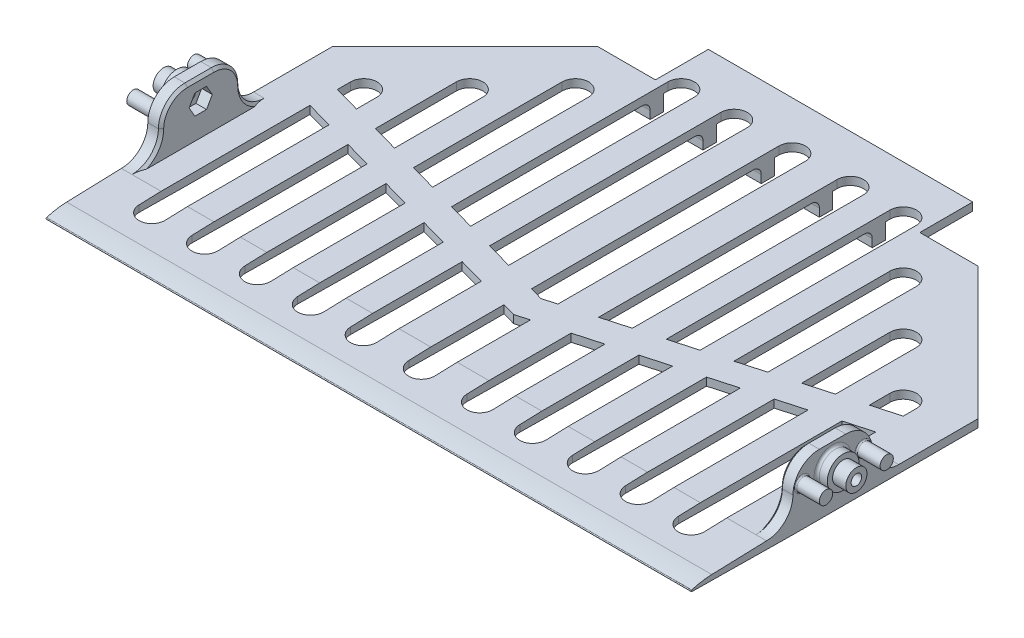
from build123d import *

# Parameters (mm, degrees)
BOSS_EXTRUDE1_DEPTH       = 3
SKETCH2_W                 = 5
SKETCH2_H                 = 30
BOSS_EXTRUDE2_DEPTH       = 20
BOSS_EXTRUDE3_DEPTH       = 4
BOSS_EXTRUDE3_DEPTH_BACK  = 244
SKETCH3_R                 = 6
SKETCH5_R                 = 2
CUT_EXTRUDE2_DEPTH        = 269.389642125
FILLET1_R                 = 10
BOSS_EXTRUDE4_START       = 5
SKETCH6_R                 = 4
SKETCH6_R_2               = 2
BOSS_EXTRUDE4_DEPTH       = 5
CUT_EXTRUDE3_DEPTH        = 238
CUT_EXTRUDE3_DEPTH_BACK   = 4
CUT_EXTRUDE4_DEPTH        = 265.697941057
FILLET9_R                 = 30
FILLET10_R                = 0.3
CUT_EXTRUDE6_DEPTH        = 167.015059558
SKETCH13_R                = 6
SKETCH13_R_2              = 2
BOSS_EXTRUDE7_DEPTH       = 4
SKETCH14_R                = 4
SKETCH14_R_2              = 2
BOSS_EXTRUDE8_DEPTH       = 5
FILLET11_R                = 1
SKETCH15_W                = 144
SKETCH15_H                = 5
BOSS_EXTRUDE9_DEPTH       = 6
FILLET12_R                = 3
BOSS_EXTRUDE10_DEPTH      = 9
BOSS_EXTRUDE10_DEPTH_BACK = 253
SKETCH16_R                = 2.5
FILLET13_R                = 0.5
CUT_EXTRUDE7_DEPTH        = 167.403124971
CUT_EXTRUDE7_DEPTH_BACK   = 167.403124971
SKETCH17_W                = 234
SKETCH17_H                = 22.465273377
CHAMFER1_SIZE             = 1
CUT_EXTRUDE8_DEPTH        = 167.015059558
BOSS_EXTRUDE11_DEPTH      = 3


# Some blends are built 0.0001 mm under size
with BuildPart() as part:
    # Sketch1 → Boss-Extrude1 (new body)
    with BuildSketch(Plane(origin=(0, 0, 0), x_dir=(1, 0, 0), z_dir=(0, 1, 0))):
        Polygon((-122, -80), (122, -80), (122, 80), (50, 80), (50, 100), (-50, 100), (-50, 80), (-122, 80), align=None)
    extrude(amount=BOSS_EXTRUDE1_DEPTH)

    # Sketch2 → Boss-Extrude2 (add)
    with BuildSketch(Plane(origin=(0, 3, 0), x_dir=(1, 0, 0), z_dir=(0, 1, 0))):
        with Locations((-119.5, -25)):
            Rectangle(SKETCH2_W, SKETCH2_H)
        with Locations((119.5, -25)):
            Rectangle(SKETCH2_W, SKETCH2_H)
    extrude(amount=BOSS_EXTRUDE2_DEPTH)

    # Sketch3 → Boss-Extrude3 (add, two sides: drawn at the far end of the back side and taken through both)
    with BuildSketch(Plane.ZY.offset(122).offset(-BOSS_EXTRUDE3_DEPTH_BACK)):
        with Locations((25, 15)):
            Circle(SKETCH3_R)
    extrude(amount=BOSS_EXTRUDE3_DEPTH + BOSS_EXTRUDE3_DEPTH_BACK)

    # Sketch5 → Cut-Extrude2 (cut, through all)
    with BuildSketch(Plane.ZY.offset(126)):
        with Locations((25, 15)):
            Circle(SKETCH5_R)
    extrude(amount=-CUT_EXTRUDE2_DEPTH, mode=Mode.SUBTRACT)

    # Fillet1
    fillet1_edges = [part.edges().sort_by_distance(p)[0] for p in [
        (119.5, 3, 40),
        (119.5, 3, 10),
        (-119.5, 3, 10),
        (-119.5, 3, 40),
    ]]
    fillet(fillet1_edges, radius=FILLET1_R)
    fillet1_2_edges = [part.edges().sort_by_distance(p)[0] for p in [
        (119.5, 23, 40),
        (119.5, 23, 10),
        (-119.5, 23, 10),
        (-119.5, 23, 40),
    ]]
    fillet(fillet1_2_edges, radius=FILLET1_R - 0.0001)  # a hair under: the kernel refuses the full size

    # Sketch6 → Boss-Extrude4 (add)
    with BuildSketch(Plane.ZY.offset(126).offset(BOSS_EXTRUDE4_START)):
        with Locations((25, 15)):
            Circle(SKETCH6_R)
        with Locations((25, 15)):
            Circle(SKETCH6_R_2, mode=Mode.SUBTRACT)
    extrude(amount=-BOSS_EXTRUDE4_DEPTH)

    # Sketch8 → Cut-Extrude3 (cut, two sides: drawn at the far end of the back side and taken through both)
    with BuildSketch(Plane.ZY.offset(-117).offset(-CUT_EXTRUDE3_DEPTH_BACK)):
        Polygon((29.387862046, 15), (27.193931023, 18.8), (22.806068977, 18.8), (20.612137954, 15), (22.806068977, 11.2), (27.193931023, 11.2), align=None)
    extrude(amount=CUT_EXTRUDE3_DEPTH + CUT_EXTRUDE3_DEPTH_BACK, mode=Mode.SUBTRACT)

    # Sketch9 → Cut-Extrude4 (cut, through all)
    with BuildSketch(Plane.ZY.offset(122)):
        Polygon((40, 0), (80, 0), (80, 0.5), align=None)
        Polygon((50, 3), (80, 2), (80, 3), align=None)
    extrude(amount=-CUT_EXTRUDE4_DEPTH, mode=Mode.SUBTRACT)

    # Fillet9
    # the kernel refuses this fillet: 30 mm, written as the material it takes off along each edge
    with BuildSketch(Plane(origin=(-145.287477803, 2, 80), x_dir=(0, -1.0, -1.3358203432240998e-12), z_dir=(1, 0, 0))) as fillet9_piece_1:
        with BuildLine():
            CenterArc((29.673019862, 10.309265341), FILLET9_R, 181.909152433, 18.189778856)
            Line((-0.310327348, 9.309820434), (-0.909994292, 9.289831536))
            Line((-0.909994292, 9.289831536), (-0.599666944, -0.019988898))
            Line((-0.599666944, -0.019988898), (0, -0.6))
            ThreePointArc((0, -0.6), (0.75, -0.6), (0.936539603, -0.206185307))
            Line((0.936539603, -0.206185307), (1.5, 0))
        make_face()
    extrude(amount=290.574955605, mode=Mode.SUBTRACT)

    # Fillet10
    fillet10_edges = [part.edges().sort_by_distance(p)[0] for p in [
        (0, 0.5, 80),
    ]]
    fillet(fillet10_edges, radius=FILLET10_R)

    # Sketch12 → Cut-Extrude6 (cut, through all)
    with BuildSketch(Plane(origin=(0, 3, 0), x_dir=(1, 0, 0), z_dir=(0, 1, 0))):
        Polygon((-72, 80), (-122, 30), (-122, 80), align=None)
        Polygon((72, 80), (122, 80), (122, 30), align=None)
    extrude(amount=-CUT_EXTRUDE6_DEPTH, mode=Mode.SUBTRACT)

    # Sketch13 → Boss-Extrude7 (add)
    with BuildSketch(Plane(origin=(122, 0, 0), x_dir=(0, 0, -1), z_dir=(1, 0, 0))):
        with Locations(Location((-25, 15, 0), (0, 0, 180))):
            Circle(SKETCH13_R)
        with Locations(Location((-25, 15, 0), (0, 0, 180))):
            Circle(SKETCH13_R_2, mode=Mode.SUBTRACT)
    extrude(amount=BOSS_EXTRUDE7_DEPTH)

    # Sketch14 → Boss-Extrude8 (add)
    with BuildSketch(Plane(origin=(126, 0, 0), x_dir=(0, 0, -1), z_dir=(1, 0, 0))):
        with Locations(Location((-25, 15, 0), (0, 0, 180))):
            Circle(SKETCH14_R)
        with Locations(Location((-25, 15, 0), (0, 0, 180))):
            Circle(SKETCH14_R_2, mode=Mode.SUBTRACT)
    extrude(amount=BOSS_EXTRUDE8_DEPTH)

    # Fillet11
    fillet11_edges = [part.edges().sort_by_distance(p)[0] for p in [
        (122, 15, 19),
        (-122, 15, 19),
    ]]
    fillet(fillet11_edges, radius=FILLET11_R)

    # Sketch15 → Boss-Extrude9 (add)
    with BuildSketch(Plane.XZ):
        with Locations((0, -77.5)):
            Rectangle(SKETCH15_W, SKETCH15_H)
    extrude(amount=BOSS_EXTRUDE9_DEPTH)

    # Fillet12
    fillet12_edges = [part.edges().sort_by_distance(p)[0] for p in [
        (0, 0, -75),
    ]]
    fillet(fillet12_edges, radius=FILLET12_R)

    # Sketch16 → Boss-Extrude10 (add, two sides: drawn at the far end of the back side and taken through both)
    with BuildSketch(Plane.ZY.offset(122).offset(-BOSS_EXTRUDE10_DEPTH_BACK)):
        with Locations((36.48, 15)):
            Circle(SKETCH16_R)
        with Locations((13.52, 15)):
            Circle(SKETCH16_R)
    extrude(amount=BOSS_EXTRUDE10_DEPTH + BOSS_EXTRUDE10_DEPTH_BACK)

    # Fillet13
    fillet13_edges = [part.edges().sort_by_distance(p)[0] for p in [
        (-122, 15, 33.98),
        (122, 15, 33.98),
        (-122, 15, 11.02),
        (122, 15, 11.02),
    ]]
    fillet(fillet13_edges, radius=FILLET13_R)

    # Sketch17 → Cut-Extrude7 (cut, two sides: drawn at the far end of the back side and taken through both)
    with BuildSketch(Plane.XY.offset(-CUT_EXTRUDE7_DEPTH_BACK)):
        with Locations((0, 16.231336637)):
            Rectangle(SKETCH17_W, SKETCH17_H)
    extrude(amount=CUT_EXTRUDE7_DEPTH + CUT_EXTRUDE7_DEPTH_BACK, mode=Mode.SUBTRACT)

    # Chamfer1
    # the kernel refuses this chamfer: 1 mm, written as the material it takes off along each edge
    with BuildSketch(Plane(origin=(117, 23, 19.9999), x_dir=(-0.0274958766105822, -0.999621916911297, 0), z_dir=(0, 0, 1)), Plane(origin=(-117, 23, 30.0001), x_dir=(0.0274958766105822, -0.999621916911297, 0), z_dir=(0, 0, -1))) as chamfer1_piece_1:
        Polygon((CHAMFER1_SIZE * 0.999621916911, CHAMFER1_SIZE * 0.0274958766106), (-CHAMFER1_SIZE * 0.0274958766106, CHAMFER1_SIZE * 0.999621916911), (0, 0), align=None)
    extrude(amount=10.0002, mode=Mode.SUBTRACT)
    with BuildSketch(Plane(origin=(117, 13.0001, 19.9999), x_dir=(0, 0, -1), z_dir=(0, -1, 0))) as chamfer1_piece_2:
        Polygon((9.9999 - CHAMFER1_SIZE, 0), (9.9999, CHAMFER1_SIZE), (9.9999, 0), align=None)
    revolve(axis=Axis((117, 13.0001, 19.9999), (1, 0, 0)), revolution_arc=90, mode=Mode.SUBTRACT)
    with BuildSketch(Plane(origin=(117, 13.0001, 30.0001), x_dir=(0, 1, 0), z_dir=(0, 0, -1))) as chamfer1_piece_3:
        Polygon((9.9999 - CHAMFER1_SIZE, 0), (9.9999, CHAMFER1_SIZE), (9.9999, 0), align=None)
    revolve(axis=Axis((117, 13.0001, 30.0001), (1, 0, 0)), revolution_arc=90, mode=Mode.SUBTRACT)
    with BuildSketch(Plane(origin=(-117, 13.0001, 30.0001), x_dir=(0, 0, 1), z_dir=(0, -1, 0))) as chamfer1_piece_4:
        Polygon((9.9999 - CHAMFER1_SIZE, 0), (9.9999, CHAMFER1_SIZE), (9.9999, 0), align=None)
    revolve(axis=Axis((-117, 13.0001, 30.0001), (-1, 0, 0)), revolution_arc=90, mode=Mode.SUBTRACT)
    with BuildSketch(Plane(origin=(-117, 13.0001, 19.9999), x_dir=(0, 1, 0), z_dir=(0, 0, 1))) as chamfer1_piece_5:
        Polygon((9.9999 - CHAMFER1_SIZE, 0), (9.9999, CHAMFER1_SIZE), (9.9999, 0), align=None)
    revolve(axis=Axis((-117, 13.0001, 19.9999), (-1, 0, 0)), revolution_arc=90, mode=Mode.SUBTRACT)
    with BuildSketch(Plane(origin=(117, 13, 50), x_dir=(0, 0, -1), z_dir=(0, 1, 0))) as chamfer1_piece_6_section:
        Polygon((10 + CHAMFER1_SIZE, 0), (10, -CHAMFER1_SIZE), (10, 0), align=None)
    chamfer1_piece_6 = revolve(axis=Axis((117, 13, 50), (-1, 0, 0)), revolution_arc=104.740577178, mode=Mode.PRIVATE)
    chamfer1_piece_6 = split(chamfer1_piece_6, bisect_by=Plane(origin=(117.284199565, 3, 39.712776606), z_dir=(0, 1, 0)), keep=Keep.TOP, mode=Mode.PRIVATE)
    add(chamfer1_piece_6, mode=Mode.SUBTRACT)
    with BuildSketch(Plane(origin=(117, 13, 0), x_dir=(2.842170943040401e-15, -0.9670877974864588, -0.25444290509422757), z_dir=(1.1455930525457092e-14, 0.25444290509422757, -0.9670877974864588))) as chamfer1_piece_7_section:
        Polygon((10 + CHAMFER1_SIZE, 0), (10, -CHAMFER1_SIZE), (10, 0), align=None)
    chamfer1_piece_7 = revolve(axis=Axis((117, 13, 0), (-1, 0, 0)), revolution_arc=104.740577178, mode=Mode.PRIVATE)
    chamfer1_piece_7 = split(chamfer1_piece_7, bisect_by=Plane(origin=(117.487389682, 3, 7.415704361), z_dir=(0, 1, 0)), keep=Keep.TOP, mode=Mode.PRIVATE)
    add(chamfer1_piece_7, mode=Mode.SUBTRACT)
    with BuildSketch(Plane(origin=(-117, 13, 0), x_dir=(0, 0, 1), z_dir=(0, 1, 0))) as chamfer1_piece_8_section:
        Polygon((10 + CHAMFER1_SIZE, 0), (10, -CHAMFER1_SIZE), (10, 0), align=None)
    chamfer1_piece_8 = revolve(axis=Axis((-117, 13, 0), (1, 0, 0)), revolution_arc=104.740577178, mode=Mode.PRIVATE)
    chamfer1_piece_8 = split(chamfer1_piece_8, bisect_by=Plane(origin=(-117.284199565, 3, 10.287223394), z_dir=(0, 1, 0)), keep=Keep.TOP, mode=Mode.PRIVATE)
    add(chamfer1_piece_8, mode=Mode.SUBTRACT)
    with BuildSketch(Plane(origin=(-117, 13, 50), x_dir=(0, -0.9670877974864587, 0.2544429050942284), z_dir=(0, 0.2544429050942284, 0.9670877974864587))) as chamfer1_piece_9_section:
        Polygon((10 + CHAMFER1_SIZE, 0), (10, -CHAMFER1_SIZE), (10, 0), align=None)
    chamfer1_piece_9 = revolve(axis=Axis((-117, 13, 50), (1, 0, 0)), revolution_arc=104.740577178, mode=Mode.PRIVATE)
    chamfer1_piece_9 = split(chamfer1_piece_9, bisect_by=Plane(origin=(-117.335701198, 3, 47.436770864), z_dir=(0, 1, 0)), keep=Keep.TOP, mode=Mode.PRIVATE)
    add(chamfer1_piece_9, mode=Mode.SUBTRACT)
    with BuildSketch(Plane(origin=(-117, 13, 40), x_dir=(0.027495876610582105, 0, -0.999621916911297), z_dir=(0, 1, 0)), Plane(origin=(117, 13, 10), x_dir=(-0.0274958766105822, 0, 0.999621916911297), z_dir=(0, 1, 0))) as chamfer1_piece_10:
        Polygon((CHAMFER1_SIZE * 0.999621916911, CHAMFER1_SIZE * 0.0274958766106), (-CHAMFER1_SIZE * 0.0274958766106, CHAMFER1_SIZE * 0.999621916911), (0, 0), align=None)
    extrude(amount=0.0001, mode=Mode.SUBTRACT)
    with BuildSketch(Plane(origin=(-117, 13, 10), x_dir=(0.027495876610582247, 0, 0.999621916911297), z_dir=(0, 1, 0)), Plane(origin=(117, 13, 40), x_dir=(-0.027495876610582105, 0, -0.999621916911297), z_dir=(0, 1, 0))) as chamfer1_piece_11:
        Polygon((CHAMFER1_SIZE * 0.999621916911, -CHAMFER1_SIZE * 0.0274958766106), (-CHAMFER1_SIZE * 0.0274958766106, -CHAMFER1_SIZE * 0.999621916911), (0, 0), align=None)
    extrude(amount=0.0001, mode=Mode.SUBTRACT)

    # Sketch18 → Cut-Extrude8 (cut, through all)
    with BuildSketch(Plane(origin=(0, 3, 0), x_dir=(1, 0, 0), z_dir=(0, 1, 0))):
        with BuildLine():
            Line((-97, 21.715728753), (-97, -58.300126367))
            ThreePointArc((-97, -58.300126367), (-102, -63.300126367), (-107, -58.300126367))
            Line((-107, -58.300126367), (-107, 21.715728753))
            ThreePointArc((-107, 21.715728753), (-102, 26.715728753), (-97, 21.715728753))
        make_face()
        with BuildLine():
            Line((-77, 41.715728753), (-77, -58.300126367))
            ThreePointArc((-77, -58.300126367), (-82, -63.300126367), (-87, -58.300126367))
            Line((-87, -58.300126367), (-87, 41.715728753))
            ThreePointArc((-87, 41.715728753), (-82, 46.715728753), (-77, 41.715728753))
        make_face()
        with BuildLine():
            Line((-57, 61.715728753), (-57, -58.300126367))
            ThreePointArc((-57, -58.300126367), (-62, -63.300126367), (-67, -58.300126367))
            Line((-67, -58.300126367), (-67, 61.715728753))
            ThreePointArc((-67, 61.715728753), (-62, 66.715728753), (-57, 61.715728753))
        make_face()
        with BuildLine():
            Line((-37, 81.715728753), (-37, -58.300126367))
            ThreePointArc((-37, -58.300126367), (-42, -63.300126367), (-47, -58.300126367))
            Line((-47, -58.300126367), (-47, 81.715728753))
            ThreePointArc((-47, 81.715728753), (-42, 86.715728753), (-37, 81.715728753))
        make_face()
        with BuildLine():
            Line((-17, 81.715728753), (-17, -58.300126367))
            ThreePointArc((-17, -58.300126367), (-22, -63.300126367), (-27, -58.300126367))
            Line((-27, -58.300126367), (-27, 81.715728753))
            ThreePointArc((-27, 81.715728753), (-22, 86.715728753), (-17, 81.715728753))
        make_face()
        with BuildLine():
            Line((97, 21.715728753), (97, -58.300126367))
            ThreePointArc((97, -58.300126367), (102, -63.300126367), (107, -58.300126367))
            Line((107, -58.300126367), (107, 21.715728753))
            ThreePointArc((107, 21.715728753), (102, 26.715728753), (97, 21.715728753))
        make_face()
        with BuildLine():
            Line((77, 41.715728753), (77, -58.300126367))
            ThreePointArc((77, -58.300126367), (82, -63.300126367), (87, -58.300126367))
            Line((87, -58.300126367), (87, 41.715728753))
            ThreePointArc((87, 41.715728753), (82, 46.715728753), (77, 41.715728753))
        make_face()
        with BuildLine():
            Line((57, 61.715728753), (57, -58.300126367))
            ThreePointArc((57, -58.300126367), (62, -63.300126367), (67, -58.300126367))
            Line((67, -58.300126367), (67, 61.715728753))
            ThreePointArc((67, 61.715728753), (62, 66.715728753), (57, 61.715728753))
        make_face()
        with BuildLine():
            Line((37, 81.715728753), (37, -58.300126367))
            ThreePointArc((37, -58.300126367), (42, -63.300126367), (47, -58.300126367))
            Line((47, -58.300126367), (47, 81.715728753))
            ThreePointArc((47, 81.715728753), (42, 86.715728753), (37, 81.715728753))
        make_face()
        with BuildLine():
            Line((17, 81.715728753), (17, -58.300126367))
            ThreePointArc((17, -58.300126367), (22, -63.300126367), (27, -58.300126367))
            Line((27, -58.300126367), (27, 81.715728753))
            ThreePointArc((27, 81.715728753), (22, 86.715728753), (17, 81.715728753))
        make_face()
        with BuildLine():
            Line((5, 81.715728753), (5, -58.300126367))
            ThreePointArc((5, -58.300126367), (0, -63.300126367), (-5, -58.300126367))
            Line((-5, -58.300126367), (-5, 81.715728753))
            ThreePointArc((-5, 81.715728753), (0, 86.715728753), (5, 81.715728753))
        make_face()
    extrude(amount=-CUT_EXTRUDE8_DEPTH, mode=Mode.SUBTRACT)

    # Sketch19 → Boss-Extrude11 (add)
    with BuildSketch(Plane(origin=(0, 3, 0), x_dir=(1, 0, 0), z_dir=(0, 1, 0))):
        Polygon((-107, 16.715728753), (0, -13.284271247), (107, 16.715728753), (107, 6.330116178), (0, -23.669883822), (-107, 6.330116178), align=None)
    extrude(amount=-BOSS_EXTRUDE11_DEPTH)


solid = part.part
